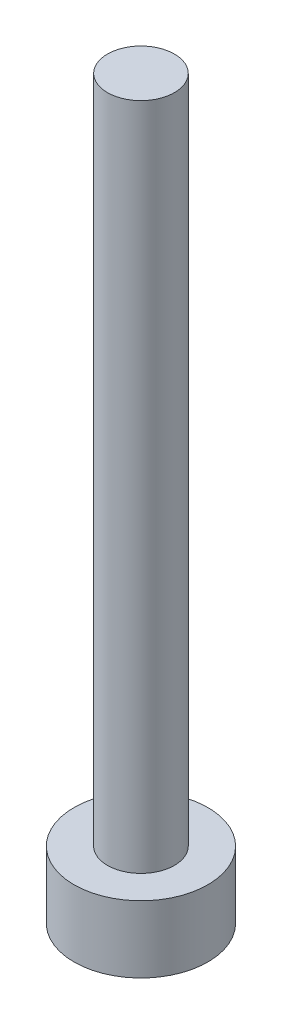
from build123d import *

# Parameters (mm, degrees)
SKETCH1_R           = 3
BOSS_EXTRUDE1_DEPTH = 3
SKETCH2_R           = 1.5
BOSS_EXTRUDE2_DEPTH = 30


with BuildPart() as part:
    # Sketch1 → Boss-Extrude1 (new body)
    with BuildSketch(Plane(origin=(0, 0, 0), x_dir=(1, 0, 0), z_dir=(0, 1, 0))):
        Circle(SKETCH1_R)
    extrude(amount=BOSS_EXTRUDE1_DEPTH)

    # Sketch2 → Boss-Extrude2 (add)
    with BuildSketch(Plane(origin=(0, 3, 0), x_dir=(1, 0, 0), z_dir=(0, 1, 0))):
        Circle(SKETCH2_R)
    extrude(amount=BOSS_EXTRUDE2_DEPTH)


solid = part.part
